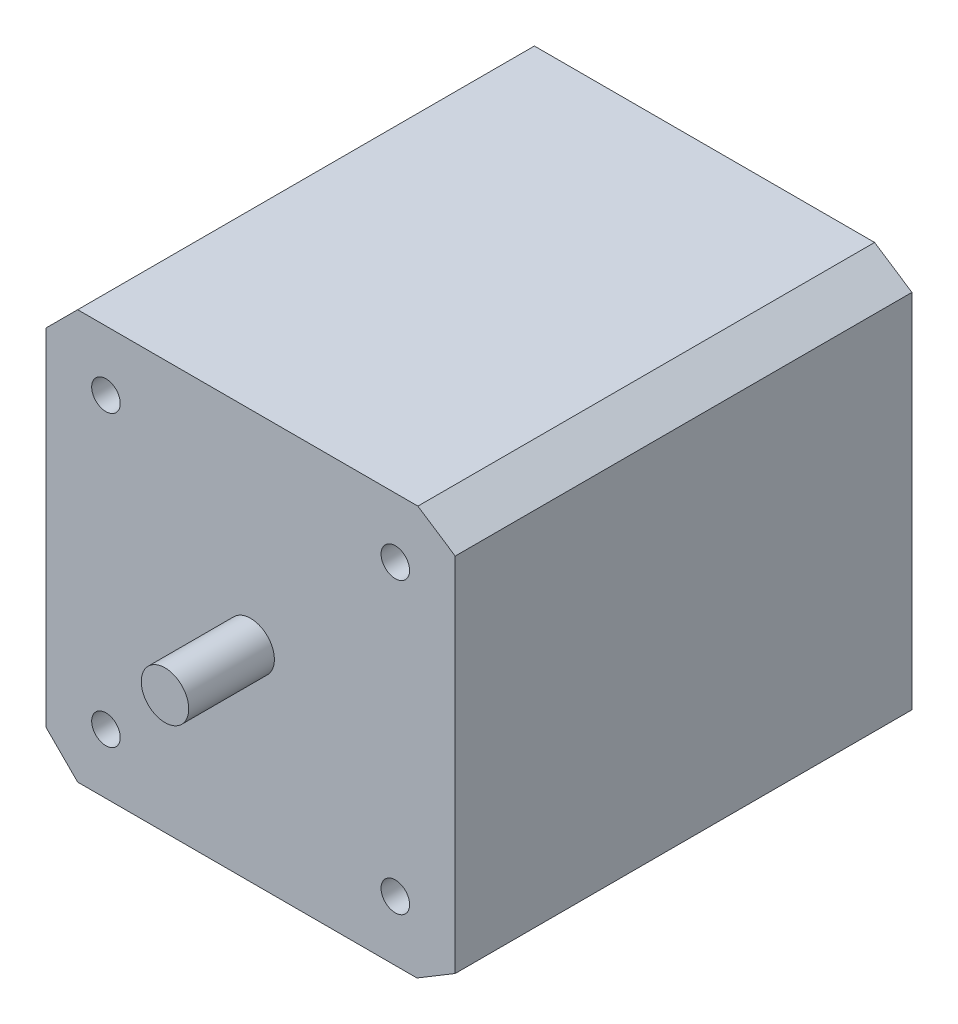
from build123d import *

# Parameters (mm, degrees)
SKETCH1_R           = 1.5
BOSS_EXTRUDE1_DEPTH = 48
SKETCH1_3_R         = 11.5
BOSS_EXTRUDE2_DEPTH = 35
SKETCH1_4_R         = 2.495506105
BOSS_EXTRUDE3_DEPTH = 57
SKETCH1_5_W         = 5.430918786
SKETCH1_5_H         = 16.000755457
BOSS_EXTRUDE4_DEPTH = 7


with BuildPart() as part:
    # Sketch1 → Boss-Extrude1 (new body)
    with BuildSketch(Plane.XY):
        Polygon((-15.184651762, 21.5), (-18.505405032, 18.179246731), (-18.505405032, -18.179246731), (-15.184651762, -21.5), (20.470167461, -21.5), (24.494594968, -19.079506704), (24.494594968, 18.915642106), (20.57338357, 21.5), align=None)
        with Locations((-12.211230799, -15.205825767)):
            Circle(SKETCH1_R, mode=Mode.SUBTRACT)
        with Locations((18.200420735, -15.205825767)):
            Circle(SKETCH1_R, mode=Mode.SUBTRACT)
        with Locations((-12.211230799, 15.205825767)):
            Circle(SKETCH1_R, mode=Mode.SUBTRACT)
        with Locations((18.200420735, 15.205825767)):
            Circle(SKETCH1_R, mode=Mode.SUBTRACT)
    extrude(amount=BOSS_EXTRUDE1_DEPTH)

    # Sketch1<3> → Boss-Extrude2 (add)
    with BuildSketch(Plane.XY):
        with Locations((2.994594968, 0)):
            Circle(SKETCH1_3_R)
    extrude(amount=BOSS_EXTRUDE2_DEPTH)

    # Sketch1<4> → Boss-Extrude3 (add)
    with BuildSketch(Plane.XY):
        with Locations((2.994594968, 0)):
            Circle(SKETCH1_4_R)
    extrude(amount=BOSS_EXTRUDE3_DEPTH)

    # Sketch1<5> → Boss-Extrude4 (add)
    with BuildSketch(Plane.XY):
        with Locations((-21.220864425, 0.037249424)):
            Rectangle(SKETCH1_5_W, SKETCH1_5_H)
    extrude(amount=BOSS_EXTRUDE4_DEPTH)


solid = part.part
